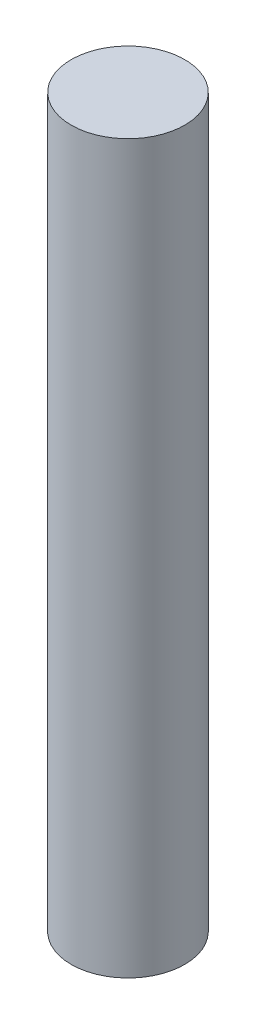
from build123d import *

# Parameters (mm, degrees)
SKETCH1_R           = 1.25
BOSS_EXTRUDE1_DEPTH = 16


with BuildPart() as part:
    # Sketch1 → Boss-Extrude1 (new body)
    with BuildSketch(Plane(origin=(0, 0, 0), x_dir=(1, 0, 0), z_dir=(0, 1, 0))):
        Circle(SKETCH1_R)
    extrude(amount=BOSS_EXTRUDE1_DEPTH)


solid = part.part
